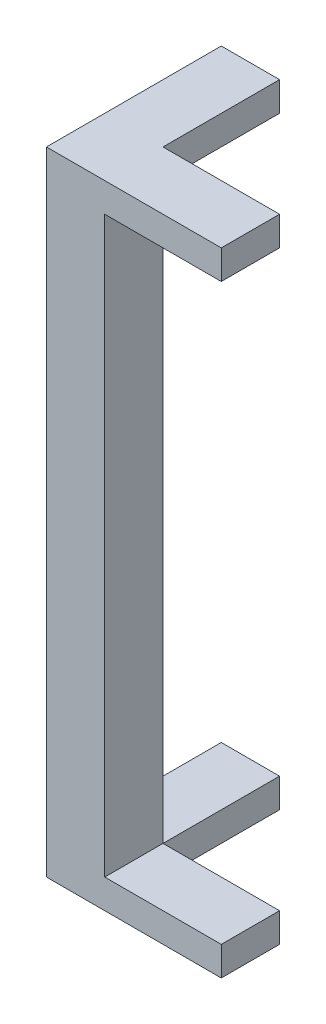
from build123d import *

# Parameters (mm, degrees)
BOSS_EXTRUDE1_DEPTH = 10
SKETCH2_W           = 10
SKETCH2_H           = 10
BOSS_EXTRUDE2_DEPTH = 93.5
BOSS_EXTRUDE3_DEPTH = 5
SKETCH4_W           = 20
SKETCH4_H           = 10
SKETCH4_W_2         = 10
SKETCH4_H_2         = 20
CUT_EXTRUDE1_DEPTH  = 5


with BuildPart() as part:
    # Sketch1 → Boss-Extrude1 (new body)
    with BuildSketch(Plane(origin=(0, 0, 0), x_dir=(1, 0, 0), z_dir=(0, 1, 0))):
        Polygon((0, 0), (30, 0), (30, 10), (10, 10), (10, 30), (0, 30), align=None)
    extrude(amount=BOSS_EXTRUDE1_DEPTH)

    # Sketch2 → Boss-Extrude2 (add)
    with BuildSketch(Plane(origin=(0, 10, 0), x_dir=(1, 0, 0), z_dir=(0, 1, 0))):
        with Locations((5, 5)):
            Rectangle(SKETCH2_W, SKETCH2_H)
    extrude(amount=BOSS_EXTRUDE2_DEPTH)

    # Sketch3 → Boss-Extrude3 (add)
    with BuildSketch(Plane(origin=(0, 103.5, 0), x_dir=(1, 0, 0), z_dir=(0, 1, 0))):
        Polygon((0, 0), (30, 0), (30, 10), (10, 10), (10, 30), (0, 30), align=None)
    extrude(amount=BOSS_EXTRUDE3_DEPTH)

    # Sketch4 → Cut-Extrude1 (cut)
    with BuildSketch(Plane(origin=(0, 10, 0), x_dir=(1, 0, 0), z_dir=(0, 1, 0))):
        with Locations((20, 5)):
            Rectangle(SKETCH4_W, SKETCH4_H)
        with Locations((5, 20)):
            Rectangle(SKETCH4_W_2, SKETCH4_H_2)
    extrude(amount=-CUT_EXTRUDE1_DEPTH, mode=Mode.SUBTRACT)


solid = part.part
